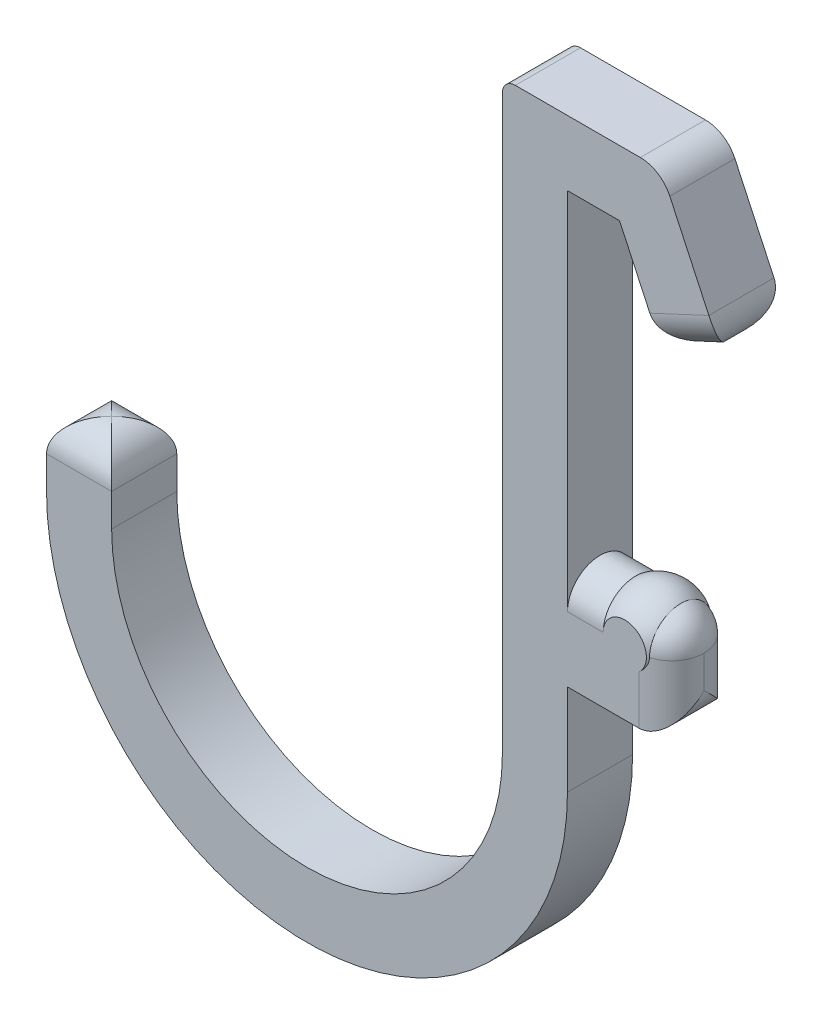
from build123d import *

# Parameters (mm, degrees)
EXTRUDE_1_DEPTH     = 5
FILLET_1_R          = 2.5
FILLET_2_R          = 1
EXTRUDE_2_DEPTH     = 8
FILLET_3_R          = 2.5
SKETCH_5_W          = 1.467751534
SKETCH_5_H          = 4.178210798
SKETCH_5_W_2        = 1.389566385
CUT_EXTRUDE_1_DEPTH = 20


with BuildPart() as part:
    # 草图1 → 凸台-拉伸1 (new body)
    with BuildSketch(Plane.XY):
        with BuildLine():
            Line((0, 0), (0, 28))
            Line((0, 28), (4, 28))
            Line((4, 28), (7.380946094, 20.749537704))
            Line((7.380946094, 20.749537704), (11.912485029, 22.862629012))
            Line((11.912485029, 22.862629012), (7.185351304, 33))
            Line((7.185351304, 33), (-5, 33))
            Line((-5, 33), (-5, -12))
            ThreePointArc((-5, -12), (-20, -27), (-35, -12))
            Line((-35, -12), (-35, -7))
            Line((-35, -7), (-40, -7))
            Line((-40, -7), (-40, -12))
            ThreePointArc((-40, -12), (-20, -32), (0, -12))
            Line((0, -12), (0, -5))
            Line((0, -5), (8, -5))
            Line((8, -5), (8, 0))
            Line((8, 0), (0, 0))
        make_face()
    extrude(amount=EXTRUDE_1_DEPTH)

    # 圆角1
    fillet_1_edges = [part.edges().sort_by_distance(p)[0] for p in [
        (-37.5, -7, 0),
        (9.646715562, 21.806083358, 0),
        (9.646715562, 21.806083358, 5),
        (-40, -7, 2.5),
        (-35, -7, 2.5),
        (7.185351304, 33, 2.5),
        (11.912485029, 22.862629012, 2.5),
        (7.380946094, 20.749537704, 2.5),
        (-37.5, -7, 5),
    ]]
    fillet(fillet_1_edges, radius=FILLET_1_R - 0.0001)  # a hair under: the kernel refuses the full size

    # 圆角2
    fillet_2_edges = [part.edges().sort_by_distance(p)[0] for p in [
        (-5, 33, 2.5),
    ]]
    fillet(fillet_2_edges, radius=FILLET_2_R)

    # 草图3 → 凸台-拉伸2 (add)
    with BuildSketch(Plane(origin=(0, 0, 0), x_dir=(0, 0, -1), z_dir=(1, 0, 0))):
        with BuildLine():
            Line((-5, 0), (0, 0))
            ThreePointArc((0, 0), (-2.5, 2.5), (-5, 0))
        make_face()
    extrude(amount=EXTRUDE_2_DEPTH)

    # 圆角3
    fillet_3_edges = [part.edges().sort_by_distance(p)[0] for p in [
        (8, -2.5, 0),
        (8, -5, 2.5),
        (8, -2.5, 5),
        (8, 2.5, 2.5),
    ]]
    fillet(fillet_3_edges, radius=FILLET_3_R - 0.0001)  # a hair under: the kernel refuses the full size

    # 草图4 → 旋转3 (revolve)
    with BuildSketch(Plane(origin=(4.4, 0, 0), x_dir=(0, 0, -1), z_dir=(1, 0, 0))):
        with BuildLine():
            Line((-5.5, 0), (0.5, 0))
            ThreePointArc((0.5, 0), (-2.5, 3), (-5.5, 0))
        make_face()
    revolve(axis=Axis((4.4, 0, 2.5), (0, 0, -1)))

    # 草图5 → 切除-拉伸1 (cut)
    with BuildSketch(Plane.ZY.offset(5)):
        with Locations((-0.733875767, -0.010051234)):
            Rectangle(SKETCH_5_W, SKETCH_5_H)
        with Locations((5.694783193, -0.010051234)):
            Rectangle(SKETCH_5_W_2, SKETCH_5_H)
    extrude(amount=-CUT_EXTRUDE_1_DEPTH, mode=Mode.SUBTRACT)


solid = part.part
